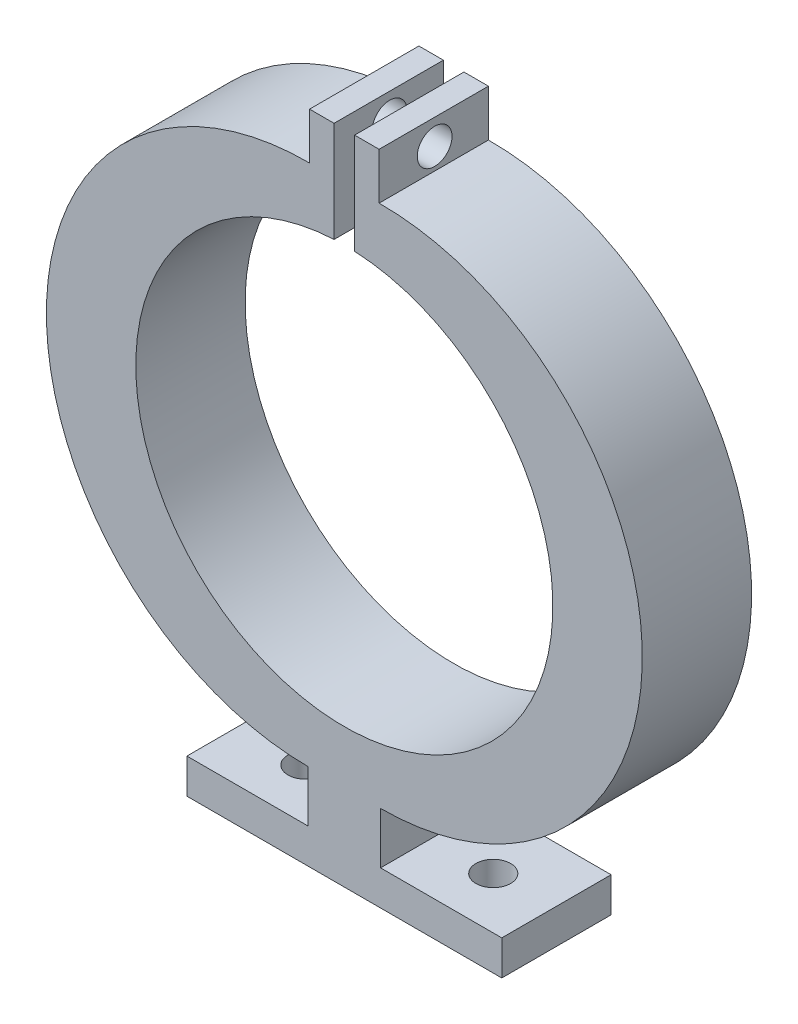
from build123d import *

# Parameters (mm, degrees)
BOSS_EXTRUDE1_DEPTH = 10
SKETCH3_R           = 19.075
CUT_EXTRUDE1_DEPTH  = 52.876336002
SKETCH4_W           = 1.877089928
SKETCH4_H           = 9.203977113
CUT_EXTRUDE2_DEPTH  = 52.876336002
SKETCH5_R           = 1.59
CUT_EXTRUDE3_DEPTH  = 10
SKETCH6_R           = 1.59
CUT_EXTRUDE4_DEPTH  = 10


with BuildPart() as part:
    # Sketch2 → Boss-Extrude1 (new body)
    with BuildSketch(Plane.XY):
        with BuildLine():
            Line((14.400910076, -17.043691534), (-14.400910076, -17.043691534))
            Line((-14.400910076, -17.043691534), (-14.400910076, -13.863691534))
            Line((-14.400910076, -13.863691534), (-3.31329987, -13.863691534))
            Line((-3.31329987, -13.863691534), (-3.31329987, -9.155292482))
            ThreePointArc((-3.31329987, -9.155292482), (-27.253207091, 14.851357712), (-3.18, 38.724336403))
            Line((-3.18, 38.724336403), (-3.18, 42.993160888))
            Line((-3.18, 42.993160888), (3.18, 42.993160888))
            Line((3.18, 42.993160888), (3.18, 38.724336403))
            ThreePointArc((3.18, 38.724336403), (27.253207091, 14.851357712), (3.31329987, -9.155292482))
            Line((3.31329987, -9.155292482), (3.31329987, -13.863691534))
            Line((3.31329987, -13.863691534), (14.400910076, -13.863691534))
            Line((14.400910076, -13.863691534), (14.400910076, -17.043691534))
        make_face()
    extrude(amount=BOSS_EXTRUDE1_DEPTH)

    # Sketch3 → Cut-Extrude1 (cut, through all)
    with BuildSketch(Plane.XY.offset(10)):
        with Locations((0, 14.737287325)):
            Circle(SKETCH3_R)
    extrude(amount=-CUT_EXTRUDE1_DEPTH, mode=Mode.SUBTRACT)

    # Sketch4 → Cut-Extrude2 (cut, through all)
    with BuildSketch(Plane.XY.offset(10)):
        with Locations((0, 38.391172332)):
            Rectangle(SKETCH4_W, SKETCH4_H)
    extrude(amount=-CUT_EXTRUDE2_DEPTH, mode=Mode.SUBTRACT)

    # Sketch5 → Cut-Extrude3 (cut)
    with BuildSketch(Plane(origin=(3.18, 0, 0), x_dir=(0, 0, -1), z_dir=(1, 0, 0))):
        with Locations((-4.919567137, 40.683465648)):
            Circle(SKETCH5_R)
    extrude(amount=-CUT_EXTRUDE3_DEPTH, mode=Mode.SUBTRACT)

    # Sketch6 → Cut-Extrude4 (cut)
    with BuildSketch(Plane(origin=(0, -13.863691534, 0), x_dir=(1, 0, 0), z_dir=(0, 1, 0))):
        with Locations((8.912608952, -5.289784221)):
            Circle(SKETCH6_R)
        with Locations((-8.273500585, -5.289784221)):
            Circle(SKETCH6_R)
    extrude(amount=-CUT_EXTRUDE4_DEPTH, mode=Mode.SUBTRACT)


solid = part.part
